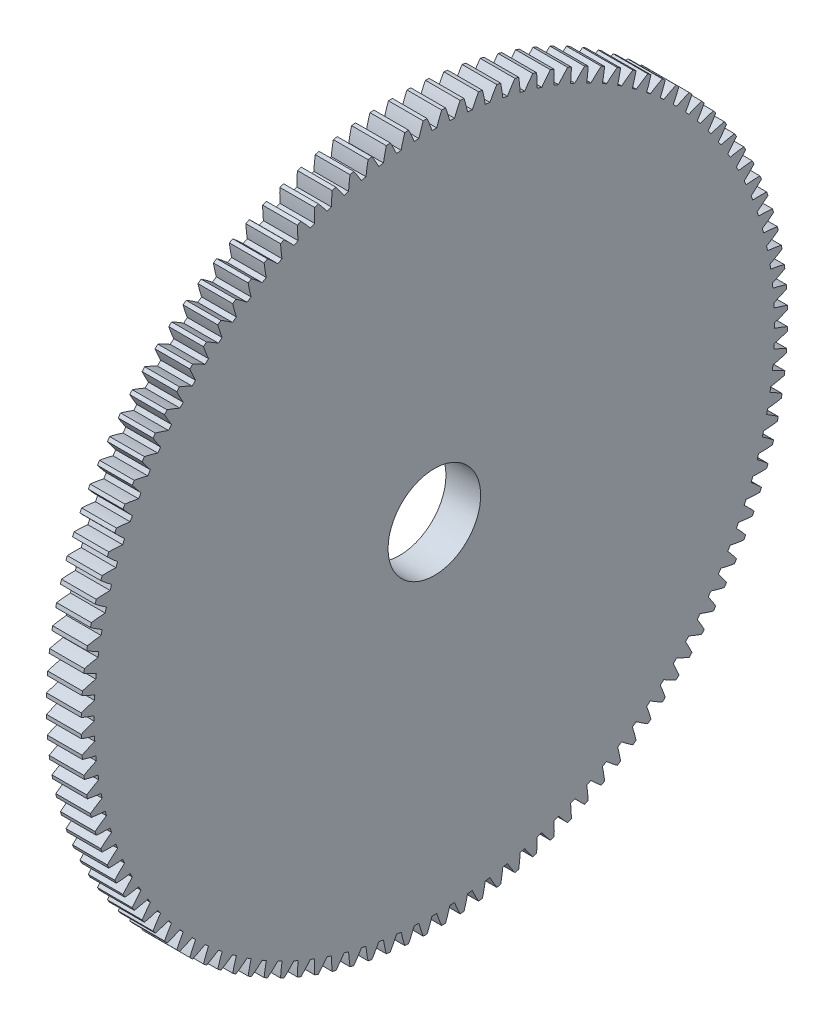
from build123d import *

# Parameters (mm, degrees)
BASPROSKE_W     = 3
BASPROSKE_H     = 30.5
TOOTHCUT_DEPTH  = 44.237715018
TEETHCUTS_COUNT = 120
TEETHCUTS_ANGLE = 357
BORSKE_R        = 4
BORE_DEPTH      = 50.0000508


with BuildPart() as part:
    # BasProSke → Base-Revolve (revolve)
    with BuildSketch(Plane(origin=(0, 0, 0), x_dir=(1, 0, 0), z_dir=(0, 1, 0)), mode=Mode.PRIVATE) as base_revolve_sk:
        with Locations((1.5, 15.25)):
            Rectangle(BASPROSKE_W, BASPROSKE_H)
    revolve(base_revolve_sk.sketch.rotate(Axis((-10, 0, 0), (1, 0, 0)), 180), axis=Axis((-10, 0, 0), (1, 0, 0)))

    # TooCutSke → ToothCut (cut, through all)
    with BuildSketch(Plane(origin=(0, 0, 0), x_dir=(0, 0, -1), z_dir=(1, 0, 0))):
        with BuildLine():
            ThreePointArc((0.205195387, 29.373283284), (0, 29.374), (-0.205195387, 29.373283284))
            ThreePointArc((-0.205195387, 29.373283284), (-0.408539527, 29.951543674), (-0.641146832, 30.518666024))
            ThreePointArc((-0.641146832, 30.518666024), (0, 30.5254), (0.641146832, 30.518666024))
            ThreePointArc((0.641146832, 30.518666024), (0.408539527, 29.951543674), (0.205195387, 29.373283284))
        make_face()
    toothcut = extrude(amount=TOOTHCUT_DEPTH, mode=Mode.SUBTRACT)

    # TeethCuts: ToothCut ×120 about axis
    teethcuts_axis = Axis((-10, 0, 0), (1, 0, 0))
    for i in range(1, TEETHCUTS_COUNT):
        add(toothcut.rotate(teethcuts_axis, i * TEETHCUTS_ANGLE / (TEETHCUTS_COUNT - 1)), mode=Mode.SUBTRACT)

    # BorSke → Bore (cut, symmetric)
    with BuildSketch(Plane(origin=(0, 0, 0), x_dir=(0, 0, -1), z_dir=(1, 0, 0))):
        with Locations(Location((0, 0, 0), (0, 0, 180))):
            Circle(BORSKE_R)
    extrude(amount=BORE_DEPTH, both=True, mode=Mode.SUBTRACT)


solid = part.part
